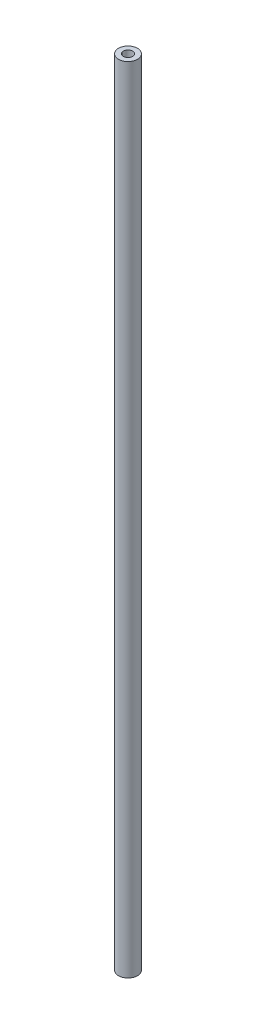
from build123d import *

# Parameters (mm, degrees)
SKETCH1_R           = 21.971
SKETCH1_R_2         = 10.668
BOSS_EXTRUDE1_DEPTH = 1828.8


with BuildPart() as part:
    # Sketch1 → Boss-Extrude1 (new body)
    with BuildSketch(Plane(origin=(0, 0, 0), x_dir=(1, 0, 0), z_dir=(0, 1, 0))):
        Circle(SKETCH1_R)
        Circle(SKETCH1_R_2, mode=Mode.SUBTRACT)
    extrude(amount=BOSS_EXTRUDE1_DEPTH)


solid = part.part
